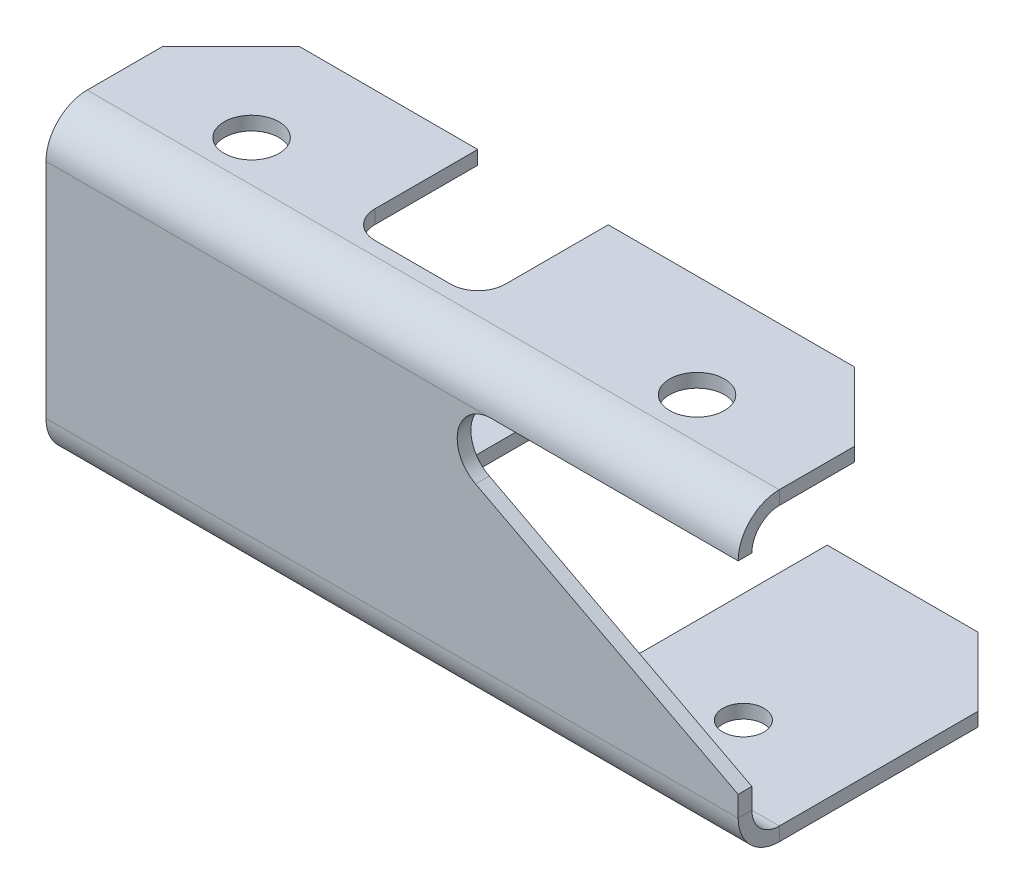
from build123d import *

# Parameters (mm, degrees)
BASE_FLANGE1_DEPTH = 160.3375
CUT_EXTRUDE1_DEPTH = 3.175
CUT_EXTRUDE2_DEPTH = 3.175
CUT_EXTRUDE3_DEPTH = 3.175
CUT_EXTRUDE4_DEPTH = 3.175
CUT_EXTRUDE5_DEPTH = 3.175
CUT_EXTRUDE6_DEPTH = 3.175
SKETCH12_R         = 6.35
CUT_EXTRUDE7_DEPTH = 3.175
SKETCH13_R         = 4.7625
CUT_EXTRUDE8_DEPTH = 3.175
CUT_EXTRUDE9_DEPTH = 3.175


# Sheet-metal steps are written as plain solids
with BuildPart() as part:
    # Sketch1 → Base-Flange1 (new body)
    with BuildSketch(Plane(origin=(0, 0, 0), x_dir=(0, 0, -1), z_dir=(1, 0, 0))):
        with BuildLine():
            Line((71.4375, 0), (9.525, 0))
            ThreePointArc((9.525, 0), (2.789807909, 2.789807909), (0, 9.525))
            Line((0, 9.525), (0, 61.11875))
            ThreePointArc((0, 61.11875), (2.789807909, 67.853942091), (9.525, 70.64375))
            Line((9.525, 70.64375), (42.8625, 70.64375))
            Line((42.8625, 70.64375), (42.8625, 67.46875))
            Line((42.8625, 67.46875), (9.525, 67.46875))
            ThreePointArc((9.525, 67.46875), (5.034871939, 65.608878061), (3.175, 61.11875))
            Line((3.175, 61.11875), (3.175, 9.525))
            ThreePointArc((3.175, 9.525), (5.034871939, 5.034871939), (9.525, 3.175))
            Line((9.525, 3.175), (71.4375, 3.175))
            Line((71.4375, 3.175), (71.4375, 0))
        make_face()
    extrude(amount=-BASE_FLANGE1_DEPTH)

    # Sketch6 → Cut-Extrude1 (cut)
    with BuildSketch(Plane(origin=(0, 3.175, 0), x_dir=(1, 0, 0), z_dir=(0, 1, 0))):
        with BuildLine():
            Line((-50.8, 71.4375), (-50.8, 28.575))
            ThreePointArc((-50.8, 28.575), (-52.659871939, 24.084871939), (-57.15, 22.225))
            Line((-57.15, 22.225), (-103.1875, 22.225))
            ThreePointArc((-103.1875, 22.225), (-107.677628061, 24.084871939), (-109.5375, 28.575))
            Line((-109.5375, 28.575), (-109.5375, 71.4375))
            Line((-109.5375, 71.4375), (-50.8, 71.4375))
        make_face()
    extrude(amount=-CUT_EXTRUDE1_DEPTH, mode=Mode.SUBTRACT)

    # Sketch7 → Cut-Extrude2 (cut)
    with BuildSketch(Plane(origin=(0, 3.175, 0), x_dir=(1, 0, 0), z_dir=(0, 1, 0))):
        Polygon((0, 71.4375), (-15.875, 71.4375), (0, 55.5625), align=None)
    extrude(amount=-CUT_EXTRUDE2_DEPTH, mode=Mode.SUBTRACT)

    # Sketch8 → Cut-Extrude3 (cut)
    with BuildSketch(Plane(origin=(0, 3.175, 0), x_dir=(1, 0, 0), z_dir=(0, 1, 0))):
        Polygon((-160.3375, 71.4375), (-144.4625, 71.4375), (-160.3375, 55.5625), align=None)
    extrude(amount=-CUT_EXTRUDE3_DEPTH, mode=Mode.SUBTRACT)

    # Sketch9 → Cut-Extrude4 (cut)
    with BuildSketch(Plane(origin=(0, 70.64375, 0), x_dir=(1, 0, 0), z_dir=(0, 1, 0))):
        Polygon((-160.3375, 42.8625), (-144.4625, 42.8625), (-160.3375, 26.9875), align=None)
    extrude(amount=-CUT_EXTRUDE4_DEPTH, mode=Mode.SUBTRACT)

    # Sketch10 → Cut-Extrude5 (cut)
    with BuildSketch(Plane(origin=(0, 70.64375, 0), x_dir=(1, 0, 0), z_dir=(0, 1, 0))):
        Polygon((0, 42.8625), (-15.875, 42.8625), (0, 26.9875), align=None)
    extrude(amount=-CUT_EXTRUDE5_DEPTH, mode=Mode.SUBTRACT)

    # Sketch11 → Cut-Extrude6 (cut)
    with BuildSketch(Plane.XY):
        with BuildLine():
            Line((0, 61.11875), (-57.15, 61.11875))
            ThreePointArc((-57.15, 61.11875), (-64.857648322, 55.07757898), (-60.83283134, 46.149844766))
            Line((-60.83283134, 46.149844766), (0, 14.2875))
            Line((0, 14.2875), (0, 61.11875))
        make_face()
    extrude(amount=-CUT_EXTRUDE6_DEPTH, mode=Mode.SUBTRACT)

    # Sketch12 → Cut-Extrude7 (cut)
    with BuildSketch(Plane(origin=(0, 70.64375, 0), x_dir=(1, 0, 0), z_dir=(0, 1, 0))):
        with Locations(Location((-28.575, 19.05, 0), (0, 0, 270))):
            Circle(SKETCH12_R)
        with Locations(Location((-131.7625, 19.05, 0), (0, 0, 270))):
            Circle(SKETCH12_R)
    extrude(amount=-CUT_EXTRUDE7_DEPTH, mode=Mode.SUBTRACT)

    # Sketch13 → Cut-Extrude8 (cut)
    with BuildSketch(Plane(origin=(0, 3.175, 0), x_dir=(1, 0, 0), z_dir=(0, 1, 0))):
        with Locations(Location((-25.4, 26.614015176, 0), (0, 0, 270))):
            Circle(SKETCH13_R)
        with Locations(Location((-134.9375, 26.614015176, 0), (0, 0, 270))):
            Circle(SKETCH13_R)
    extrude(amount=-CUT_EXTRUDE8_DEPTH, mode=Mode.SUBTRACT)

    # Sketch14 → Cut-Extrude9 (cut)
    with BuildSketch(Plane(origin=(0, 70.64375, 0), x_dir=(1, 0, 0), z_dir=(0, 1, 0))):
        with BuildLine():
            Line((-72.9615, 42.8625), (-72.9615, 19.05))
            ThreePointArc((-72.9615, 19.05), (-74.821371939, 14.559871939), (-79.3115, 12.7))
            Line((-79.3115, 12.7), (-96.8375, 12.7))
            ThreePointArc((-96.8375, 12.7), (-101.327628061, 14.559871939), (-103.1875, 19.05))
            Line((-103.1875, 19.05), (-103.1875, 42.8625))
            Line((-103.1875, 42.8625), (-72.9615, 42.8625))
        make_face()
    extrude(amount=-CUT_EXTRUDE9_DEPTH, mode=Mode.SUBTRACT)


solid = part.part
